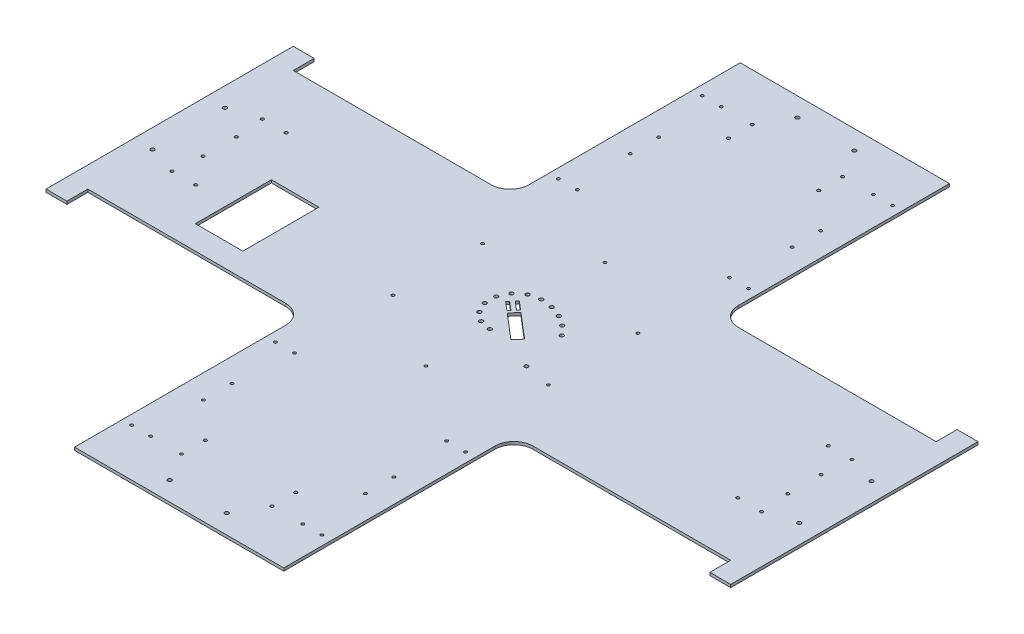
from build123d import *

# Parameters (mm, degrees)
BOSS_EXTRUDE1_DEPTH = 3
SKETCH2_R           = 1.6
CUT_EXTRUDE1_DEPTH  = 503.104570782
SKETCH3_R           = 2
CUT_EXTRUDE2_DEPTH  = 503.104570782
SKETCH4_R           = 2
SKETCH4_R_2         = 1.5
CUT_EXTRUDE3_DEPTH  = 10
SKETCH5_R           = 1.5
CUT_EXTRUDE4_DEPTH  = 10
FILLET1_R           = 20
SKETCH7_W           = 50
SKETCH7_H           = 80
CUT_EXTRUDE5_DEPTH  = 10


with BuildPart() as part:
    # Sketch1 → Boss-Extrude1 (new body)
    with BuildSketch(Plane(origin=(0, 0, 0), x_dir=(1, 0, 0), z_dir=(0, 1, 0))):
        Polygon((-110, 350), (-110, 108), (-338, 108), (-338, 130), (-360, 130), (-360, -130), (-338, -130), (-338, -108), (-110, -108), (-110, -350), (110, -350), (110, -108), (338, -108), (338, -130), (360, -130), (360, 130), (338, 130), (338, 108), (110, 108), (110, 350), align=None)
    extrude(amount=BOSS_EXTRUDE1_DEPTH)

    # Sketch2 → Cut-Extrude1 (cut, through all)
    with BuildSketch(Plane(origin=(0, 3, 0), x_dir=(1, 0, 0), z_dir=(0, 1, 0))):
        with Locations((310, 47.5)):
            Circle(SKETCH2_R)
        with Locations((285, 47.5)):
            Circle(SKETCH2_R)
        with Locations((307.5, 17.5)):
            Circle(SKETCH2_R)
        with Locations((307.5, -17.5)):
            Circle(SKETCH2_R)
        with Locations((310, -47.5)):
            Circle(SKETCH2_R)
        with Locations((285, -47.5)):
            Circle(SKETCH2_R)
        with Locations((-285, -47.5)):
            Circle(SKETCH2_R)
        with Locations((-310, -47.5)):
            Circle(SKETCH2_R)
        with Locations((-307.5, -17.5)):
            Circle(SKETCH2_R)
        with Locations((-307.5, 17.5)):
            Circle(SKETCH2_R)
        with Locations((-285, 47.5)):
            Circle(SKETCH2_R)
        with Locations((-310, 47.5)):
            Circle(SKETCH2_R)
        with Locations((47.5, 300)):
            Circle(SKETCH2_R)
        with Locations((47.5, 275)):
            Circle(SKETCH2_R)
        with Locations((-47.5, 275)):
            Circle(SKETCH2_R)
        with Locations((-47.5, 300)):
            Circle(SKETCH2_R)
        with Locations((-47.5, -300)):
            Circle(SKETCH2_R)
        with Locations((-47.5, -275)):
            Circle(SKETCH2_R)
        with Locations((47.5, -275)):
            Circle(SKETCH2_R)
        with Locations((47.5, -300)):
            Circle(SKETCH2_R)
    extrude(amount=-CUT_EXTRUDE1_DEPTH, mode=Mode.SUBTRACT)

    # Sketch3 → Cut-Extrude2 (cut, through all)
    with BuildSketch(Plane(origin=(0, 3, 0), x_dir=(1, 0, 0), z_dir=(0, 1, 0))):
        with Locations((340, 38)):
            Circle(SKETCH3_R)
        with Locations((340, -38)):
            Circle(SKETCH3_R)
        with Locations((-340, -38)):
            Circle(SKETCH3_R)
        with Locations((-340, 38)):
            Circle(SKETCH3_R)
        with Locations((-30, 330)):
            Circle(SKETCH3_R)
        with Locations((30, 330)):
            Circle(SKETCH3_R)
        with Locations((30, -330)):
            Circle(SKETCH3_R)
        with Locations((-30, -330)):
            Circle(SKETCH3_R)
    extrude(amount=-CUT_EXTRUDE2_DEPTH, mode=Mode.SUBTRACT)

    # Sketch4 → Cut-Extrude3 (cut)
    with BuildSketch(Plane(origin=(0, 3, 0), x_dir=(1, 0, 0), z_dir=(0, 1, 0))):
        with Locations((0.808520266, 29.830132062)):
            Circle(SKETCH4_R)
        with Locations((13.346143391, 28.330403085)):
            Circle(SKETCH4_R)
        with Locations((25.203013099, 23.988074058)):
            Circle(SKETCH4_R)
        with Locations((35.760220631, 17.060841581)):
            Circle(SKETCH4_R)
        with Locations((44.463500299, 7.912393424)):
            Circle(SKETCH4_R)
        with Locations((53.928254969, -38.753193613)):
            Circle(SKETCH4_R)
        with Locations((-10.859337922, 27.178870948)):
            Circle(SKETCH4_R)
        with Locations((-20.281408497, 19.688806529)):
            Circle(SKETCH4_R)
        with Locations((-25.512210732, 8.848364338)):
            Circle(SKETCH4_R)
        with Locations((-25.512210732, -3.188100214)):
            Circle(SKETCH4_R)
        with Locations((-20.281408497, -14.028542405)):
            Circle(SKETCH4_R)
        with Locations((-10.859337922, -21.518606823)):
            Circle(SKETCH4_R)
        with Locations((0.881523066, -24.169769245)):
            Circle(SKETCH4_R)
        with Locations((0.808520266, 97.080132062)):
            Circle(SKETCH4_R_2)
        with Locations((82.431414572, 49.955132062)):
            Circle(SKETCH4_R_2)
        with Locations((82.431414572, -44.294867938)):
            Circle(SKETCH4_R_2)
        with Locations((0.808520266, -91.419867938)):
            Circle(SKETCH4_R_2)
        with Locations((-80.814374041, -44.294867938)):
            Circle(SKETCH4_R_2)
        with Locations((-80.814374041, 49.955132062)):
            Circle(SKETCH4_R_2)
        Polygon((-4.591750043, -0.423359002), (21.666877407, -22.800456322), (28.282714875, -15.037036032), (2.024087426, 7.340061288), align=None)
        Polygon((-6.875108951, 1.522475548), (-4.929274402, 3.805834456), (-14.062710037, 11.589172655), (-16.008544586, 9.305813746), align=None)
        Polygon((-2.205106032, 7.002536929), (-0.259271483, 9.285895837), (-9.392707118, 17.069234035), (-11.338541667, 14.785875127), align=None)
    extrude(amount=-CUT_EXTRUDE3_DEPTH, mode=Mode.SUBTRACT)

    # Sketch5 → Cut-Extrude4 (cut)
    with BuildSketch(Plane(origin=(0, 3, 0), x_dir=(1, 0, 0), z_dir=(0, 1, 0))):
        with Locations((80, 300)):
            Circle(SKETCH5_R)
        with Locations((80, 148.73)):
            Circle(SKETCH5_R)
        with Locations((85.11, 239.365)):
            Circle(SKETCH5_R)
        with Locations((85.11, 209.365)):
            Circle(SKETCH5_R)
        with Locations((100, 148.73)):
            Circle(SKETCH5_R)
        with Locations((100, 300)):
            Circle(SKETCH5_R)
        with Locations((-100, 300)):
            Circle(SKETCH5_R)
        with Locations((-100, 148.73)):
            Circle(SKETCH5_R)
        with Locations((-85.11, 209.365)):
            Circle(SKETCH5_R)
        with Locations((-85.11, 239.365)):
            Circle(SKETCH5_R)
        with Locations((-80, 148.73)):
            Circle(SKETCH5_R)
        with Locations((-80, 300)):
            Circle(SKETCH5_R)
        with Locations((-80, -300)):
            Circle(SKETCH5_R)
        with Locations((-80, -148.73)):
            Circle(SKETCH5_R)
        with Locations((-85.11, -239.365)):
            Circle(SKETCH5_R)
        with Locations((-85.11, -209.365)):
            Circle(SKETCH5_R)
        with Locations((-100, -148.73)):
            Circle(SKETCH5_R)
        with Locations((-100, -300)):
            Circle(SKETCH5_R)
        with Locations((100, -300)):
            Circle(SKETCH5_R)
        with Locations((100, -148.73)):
            Circle(SKETCH5_R)
        with Locations((85.11, -209.365)):
            Circle(SKETCH5_R)
        with Locations((85.11, -239.365)):
            Circle(SKETCH5_R)
        with Locations((80, -148.73)):
            Circle(SKETCH5_R)
        with Locations((80, -300)):
            Circle(SKETCH5_R)
    extrude(amount=-CUT_EXTRUDE4_DEPTH, mode=Mode.SUBTRACT)

    # Fillet1
    fillet1_edges = [part.edges().sort_by_distance(p)[0] for p in [
        (110, 1.5, -108),
        (-110, 1.5, -108),
        (-110, 1.5, 108),
        (110, 1.5, 108),
    ]]
    fillet(fillet1_edges, radius=FILLET1_R)

    # Sketch7 → Cut-Extrude5 (cut)
    with BuildSketch(Plane(origin=(0, 3, 0), x_dir=(1, 0, 0), z_dir=(0, 1, 0))):
        with Locations((-225, -43)):
            Rectangle(SKETCH7_W, SKETCH7_H)
    extrude(amount=-CUT_EXTRUDE5_DEPTH, mode=Mode.SUBTRACT)


solid = part.part
